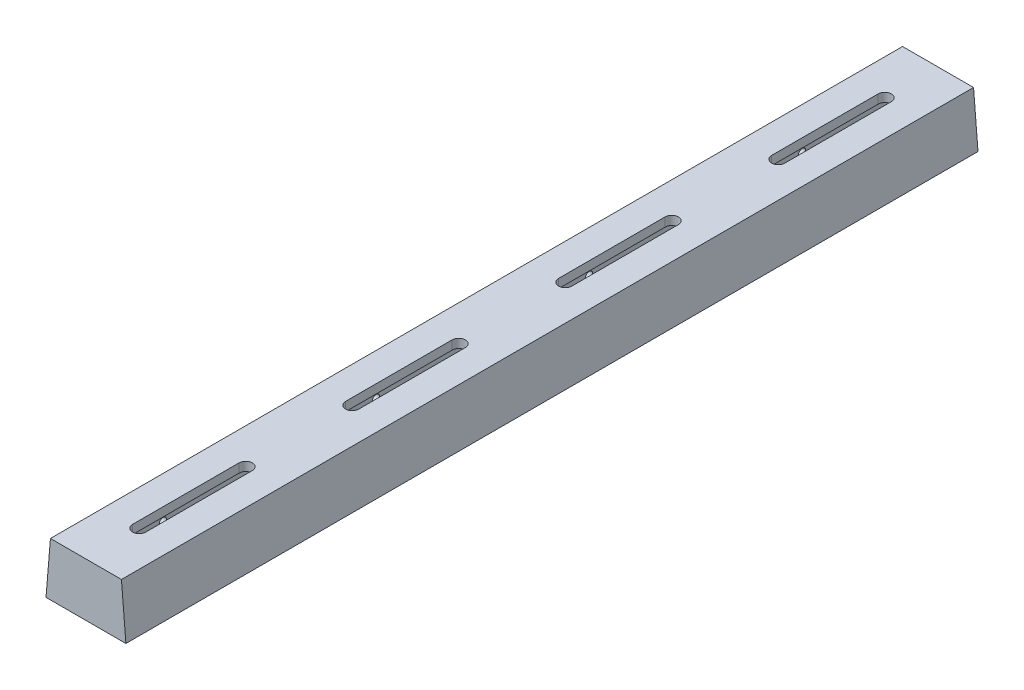
from build123d import *

# Parameters (mm, degrees)
BOSS_EXTRUDE1_DEPTH          = 304.8
SHELL1_T                     = -6.35
CUT_EXTRUDE1_DEPTH           = 309.49826681
RIB2_START                   = -22.202989535
RIB2_DEPTH                   = 44.40597907
LPATTERN1_COUNT              = 3
LPATTERN1_PITCH              = 152.4
LPATTERN2_COUNT              = 2
LPATTERN2_PITCH              = 152.4
MIRROR1_COPY_1_DEPTH         = 309.49826681
BOSS_EXTRUDE2_REACH          = 314.443
SKETCH5_W                    = 19.05
SKETCH5_H                    = 25.4
MIRROR4_COPY_1_REACH         = 314.443
MIRROR4_COPY_1_SKETCH_W      = 19.05
MIRROR4_COPY_1_SKETCH_H      = 25.4
F_1_4_20_TAPPED_HOLE1_REACH  = 314.443
F_1_4_20_TAPPED_HOLE1_BORE_R = 2.5527


# Read off the part's stored shape, not the designer's step: Rib2
with BuildPart() as part:
    # Sketch1 → Boss-Extrude1 (new, symmetric)
    with BuildSketch(Plane.XY):
        Polygon((28.575, -38.1), (-28.575, -38.1), (-25.4, 0), (25.4, 0), align=None)
    extrude(amount=BOSS_EXTRUDE1_DEPTH, both=True)

    # Shell1
    shell1_openings = [part.faces().sort_by_distance(p)[0] for p in [
        (0, -38.1, 0),
    ]]
    offset(amount=SHELL1_T, openings=shell1_openings, kind=Kind.INTERSECTION)

    # Sketch2 → Cut-Extrude1 (cut, symmetric)
    with BuildSketch(Plane(origin=(0, 0, 0), x_dir=(1, 0, 0), z_dir=(0, 1, 0))):
        with BuildLine():
            Line((4.7625, -38.1), (4.7625, -114.3))
            ThreePointArc((4.7625, -114.3), (0, -119.0625), (-4.7625, -114.3))
            Line((-4.7625, -114.3), (-4.7625, -38.1))
            ThreePointArc((-4.7625, -38.1), (0, -33.3375), (4.7625, -38.1))
        make_face()
    cut_extrude1 = extrude(amount=CUT_EXTRUDE1_DEPTH, both=True, mode=Mode.SUBTRACT)

    # Rib2 outline → Rib2 (add)
    with BuildSketch(Plane.YZ.offset(RIB2_START)):
        Polygon((-6.35, 146.447234933), (-6.35, 158.352765067), (-38.1, 155.575), (-38.1, 149.225), align=None)
    rib2 = extrude(amount=RIB2_DEPTH)

    # LPattern1: Rib2 ×3
    with Locations(*[(0, 0, -i * LPATTERN1_PITCH) for i in range(1, LPATTERN1_COUNT)]):
        add(rib2)

    # LPattern2: Cut-Extrude1 ×2
    with Locations(*[(0, 0, i * LPATTERN2_PITCH) for i in range(1, LPATTERN2_COUNT)]):
        add(cut_extrude1, mode=Mode.SUBTRACT)

    # Mirror1: Cut-Extrude1 across plane
    add(cut_extrude1.mirror(Plane.XY), mode=Mode.SUBTRACT)

    # Mirror1 copy 1 sketch → Mirror1 copy 1 (cut, symmetric)
    with BuildSketch(Plane(origin=(0, 0, -152.4), x_dir=(1, 0, 0), z_dir=(0, 1, 0))):
        with BuildLine():
            Line((4.7625, 38.1), (4.7625, 114.3))
            ThreePointArc((4.7625, 114.3), (0, 119.0625), (-4.7625, 114.3))
            Line((-4.7625, 114.3), (-4.7625, 38.1))
            ThreePointArc((-4.7625, 38.1), (0, 33.3375), (4.7625, 38.1))
        make_face()
    extrude(amount=MIRROR1_COPY_1_DEPTH, both=True, mode=Mode.SUBTRACT)

    # Sketch5 → Boss-Extrude2 (add, up to next)
    with BuildSketch(Plane(origin=(-28.575, 0, 0), x_dir=(0, 0, -1), z_dir=(1, 0, 0)), mode=Mode.PRIVATE) as boss_extrude2_sk1:
        with Locations((-76.2, -25.4)):
            Rectangle(SKETCH5_W, SKETCH5_H)
    boss_extrude2_tool1 = extrude(boss_extrude2_sk1.sketch, amount=BOSS_EXTRUDE2_REACH, mode=Mode.PRIVATE) - part.part
    boss_extrude2 = boss_extrude2_tool1.solids().sort_by_distance((-28.575, -25.4, 76.2))[0]
    add(boss_extrude2)

    # Mirror2: Boss-Extrude2 across plane
    add(boss_extrude2.mirror(Plane.XY))

    # Mirror3: Boss-Extrude2 across plane
    add(boss_extrude2.mirror(Plane.XY.offset(152.4)))

    # Mirror4 copy 1 sketch → Mirror4 copy 1 (add, up to next)
    with BuildSketch(Plane(origin=(-28.575, 0, -304.8), x_dir=(0, 0, -1), z_dir=(1, 0, 0)), mode=Mode.PRIVATE) as mirror4_copy_1_sk1:
        with Locations((-76.2, -25.4)):
            Rectangle(MIRROR4_COPY_1_SKETCH_W, MIRROR4_COPY_1_SKETCH_H)
    mirror4_copy_1_tool1 = extrude(mirror4_copy_1_sk1.sketch, amount=MIRROR4_COPY_1_REACH, mode=Mode.PRIVATE) - part.part
    add(mirror4_copy_1_tool1.solids().sort_by_distance((-28.575, -25.4, -228.6))[0])

    # 1/4-20 Tapped Hole1 bore → 1/4-20 Tapped Hole1 (cut, up to next)
    with BuildSketch(Plane.ZY.offset(28.575), mode=Mode.PRIVATE) as f_1_4_20_tapped_hole1_sk1:
        with Locations((-228.6, -25.4)):
            Circle(F_1_4_20_TAPPED_HOLE1_BORE_R)
    f_1_4_20_tapped_hole1_tool1 = extrude(f_1_4_20_tapped_hole1_sk1.sketch, amount=-F_1_4_20_TAPPED_HOLE1_REACH, mode=Mode.PRIVATE) & part.part
    # 1/4-20 Tapped Hole1 bore → 1/4-20 Tapped Hole1 (cut, up to next)
    with BuildSketch(Plane.ZY.offset(28.575), mode=Mode.PRIVATE) as f_1_4_20_tapped_hole1_sk2:
        with Locations((-76.2, -25.4)):
            Circle(F_1_4_20_TAPPED_HOLE1_BORE_R)
    f_1_4_20_tapped_hole1_tool2 = extrude(f_1_4_20_tapped_hole1_sk2.sketch, amount=-F_1_4_20_TAPPED_HOLE1_REACH, mode=Mode.PRIVATE) & part.part
    # 1/4-20 Tapped Hole1 bore → 1/4-20 Tapped Hole1 (cut, up to next)
    with BuildSketch(Plane.ZY.offset(28.575), mode=Mode.PRIVATE) as f_1_4_20_tapped_hole1_sk3:
        with Locations((76.2, -25.4)):
            Circle(F_1_4_20_TAPPED_HOLE1_BORE_R)
    f_1_4_20_tapped_hole1_tool3 = extrude(f_1_4_20_tapped_hole1_sk3.sketch, amount=-F_1_4_20_TAPPED_HOLE1_REACH, mode=Mode.PRIVATE) & part.part
    # 1/4-20 Tapped Hole1 bore → 1/4-20 Tapped Hole1 (cut, up to next)
    with BuildSketch(Plane.ZY.offset(28.575), mode=Mode.PRIVATE) as f_1_4_20_tapped_hole1_sk4:
        with Locations((228.6, -25.4)):
            Circle(F_1_4_20_TAPPED_HOLE1_BORE_R)
    f_1_4_20_tapped_hole1_tool4 = extrude(f_1_4_20_tapped_hole1_sk4.sketch, amount=-F_1_4_20_TAPPED_HOLE1_REACH, mode=Mode.PRIVATE) & part.part
    add(f_1_4_20_tapped_hole1_tool1.solids().sort_by_distance((-28.575, -25.4, -228.6))[0], mode=Mode.SUBTRACT)
    add(f_1_4_20_tapped_hole1_tool2.solids().sort_by_distance((-28.575, -25.4, -76.2))[0], mode=Mode.SUBTRACT)
    add(f_1_4_20_tapped_hole1_tool3.solids().sort_by_distance((-28.575, -25.4, 76.2))[0], mode=Mode.SUBTRACT)
    add(f_1_4_20_tapped_hole1_tool4.solids().sort_by_distance((-28.575, -25.4, 228.6))[0], mode=Mode.SUBTRACT)


solid = part.part
